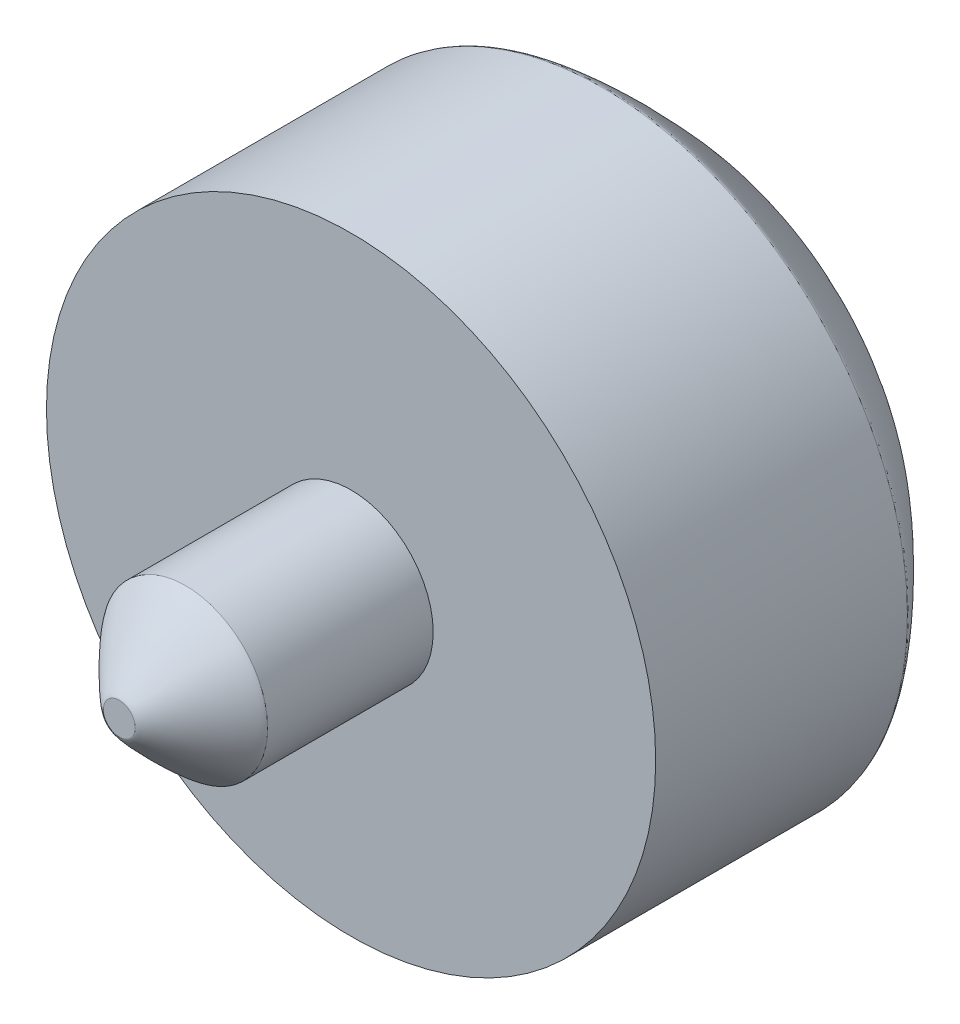
from build123d import *

# Parameters (mm, degrees)
SKETCH_1_R      = 4.6
EXTRUDE_1_DEPTH = 5
SKETCH_2_R      = 1.24
EXTRUDE_2_DEPTH = 3.5
FILLET_1_SIZE   = 1
FILLET_2_SIZE   = 1.2


with BuildPart() as part:
    # 草图1 → 凸台-拉伸1 (new body)
    with BuildSketch(Plane.XY):
        Circle(SKETCH_1_R)
    extrude(amount=EXTRUDE_1_DEPTH)

    # 草图2 → 凸台-拉伸2 (add)
    with BuildSketch(Plane.XY.offset(5)):
        Circle(SKETCH_2_R)
    extrude(amount=EXTRUDE_2_DEPTH)

    # 圆角1
    # a fillet whose section is not a circle: 1 mm, written as the material it takes off along each edge
    with BuildSketch(Plane(origin=(0, 0, 8.5), x_dir=(1, 0, 0), z_dir=(0, -1, 0))) as fillet_1_piece_1:
        with BuildLine():
            Bezier((1.24, -FILLET_1_SIZE), (1.24, 0), (1.24 - FILLET_1_SIZE, 0), weights=[1, 0.070710678, 1])
            Line((1.24 - FILLET_1_SIZE, 0), (1.24, 0))
            Line((1.24, 0), (1.24, -FILLET_1_SIZE))
        make_face()
    revolve(axis=Axis((0, 0, 8.5), (0, 0, 1)), mode=Mode.SUBTRACT)

    # 圆角2
    # a fillet whose section is not a circle: 1.2 mm, written as the material it takes off along each edge
    with BuildSketch(Plane(origin=(0, 0, 0), x_dir=(1, 0, 0), z_dir=(0, -1, 0))) as fillet_2_piece_1:
        with BuildLine():
            Bezier((4.6, FILLET_2_SIZE), (4.6, 0), (4.6 - FILLET_2_SIZE, 0), weights=[1, 0.084852814, 1])
            Line((4.6 - FILLET_2_SIZE, 0), (4.6, 0))
            Line((4.6, 0), (4.6, FILLET_2_SIZE))
        make_face()
    revolve(axis=Axis((0, 0, 0), (0, 0, 1)), mode=Mode.SUBTRACT)


solid = part.part
